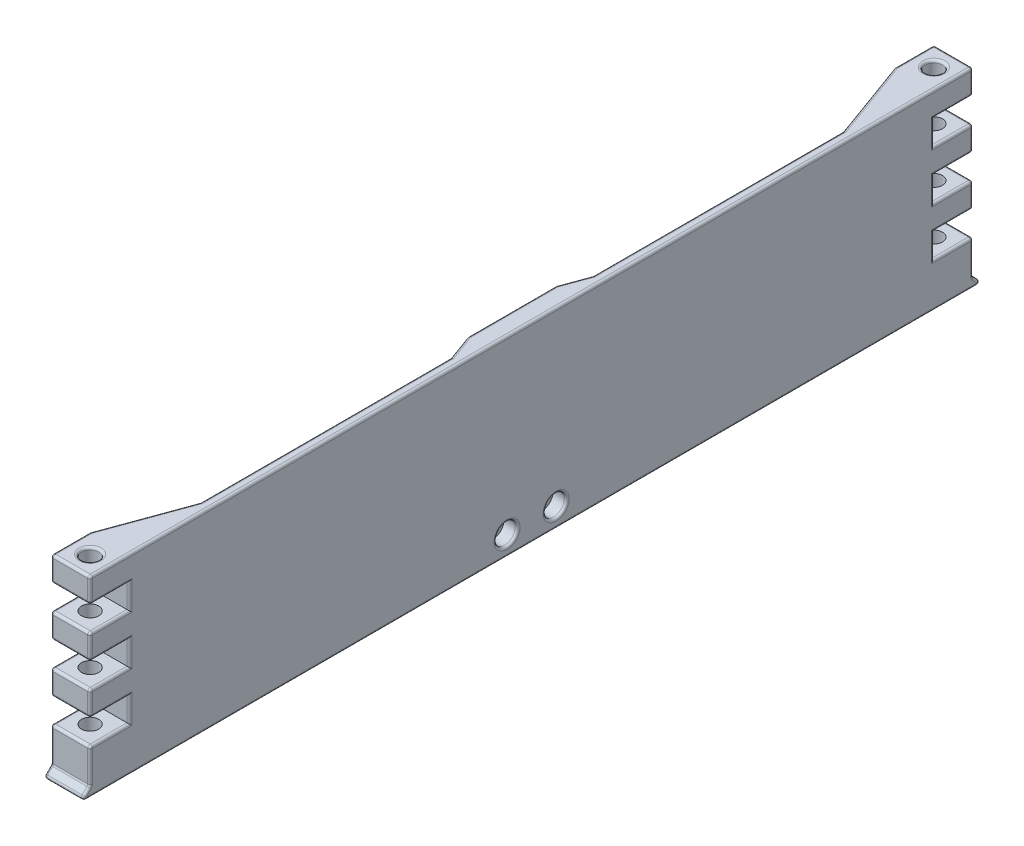
from build123d import *

# Parameters (mm, degrees)
SKETCH1_R               = 2.15
BOSS_EXTRUDE1_DEPTH     = 8
SKETCH1_3_R             = 2.15
BOSS_EXTRUDE2_DEPTH     = 5.2
CUT_EXTRUDE3_DEPTH      = 62.595454378
CUT_EXTRUDE3_DEPTH_BACK = 62.595454378
SKETCH7_R               = 1.75
CUT_EXTRUDE4_DEPTH      = 62.595454378
CUT_EXTRUDE4_DEPTH_BACK = 6
SKETCH7_3_R             = 1.75
CUT_EXTRUDE5_DEPTH      = 62.595454378
FILLET1_R               = 0.5


with BuildPart() as part:
    # Sketch1 → Boss-Extrude1 (new body)
    with BuildSketch(Plane(origin=(0, 0, 0), x_dir=(0, 0, -1), z_dir=(1, 0, 0))):
        Polygon((-47, -19.5), (-45, -19.5), (45, -19.5), (45, 19.5), (-37, 19.5), (-45, 19.5), (-45, 14.5), (-37, 14.5), (-37, 9.5), (-45, 9.5), (-45, 4.5), (-37, 4.5), (-37, -0.5), (-45, -0.5), (-45, -5.5), (-37, -5.5), (-37, -10.5), (-45, -10.5), (-45, -17.5), align=None)
        with Locations((40, -15.5)):
            Circle(SKETCH1_R, mode=Mode.SUBTRACT)
    extrude(amount=BOSS_EXTRUDE1_DEPTH)

    # Sketch1<3> → Boss-Extrude2 (add)
    with BuildSketch(Plane(origin=(0, 0, 0), x_dir=(0, 0, -1), z_dir=(1, 0, 0))):
        with Locations((40, -15.5)):
            Circle(SKETCH1_3_R)
    extrude(amount=BOSS_EXTRUDE2_DEPTH)

    # Sketch7 → Cut-Extrude3 (cut, two sides: drawn at the far end of the back side and taken through both)
    with BuildSketch(Plane.XZ.offset(19.5).offset(-CUT_EXTRUDE3_DEPTH_BACK)):
        with Locations((4, 41)):
            Circle(SKETCH7_R)
    extrude(amount=CUT_EXTRUDE3_DEPTH + CUT_EXTRUDE3_DEPTH_BACK, mode=Mode.SUBTRACT)

    # Sketch7<3> → Cut-Extrude4 (cut, two sides: drawn at the far end of the back side and taken through both)
    with BuildSketch(Plane.XZ.offset(19.5).offset(-CUT_EXTRUDE4_DEPTH_BACK)):
        Polygon((1.175, 42.63101451), (1.175, 39.36898549), (4, 37.737970979), (6.825, 39.36898549), (6.825, 42.63101451), (4, 44.262029021), align=None)
        with Locations((4, 41)):
            Circle(SKETCH7_3_R, mode=Mode.SUBTRACT)
    extrude(amount=CUT_EXTRUDE4_DEPTH + CUT_EXTRUDE4_DEPTH_BACK, mode=Mode.SUBTRACT)

    # Sketch8 → Cut-Extrude5 (cut, through all)
    with BuildSketch(Plane(origin=(0, 19.5, 0), x_dir=(1, 0, 0), z_dir=(0, 1, 0))):
        Polygon((0, 45), (0, -37), (6, -20.515135483), (6, 30.505045161), (4, 36), (4, 45), align=None)
    extrude(amount=-CUT_EXTRUDE5_DEPTH, mode=Mode.SUBTRACT)

    # Mirror2: part across plane


with BuildPart() as part_1:
    add(part.part)
    add(part.part.mirror(Plane(origin=(8, 0, -45), x_dir=(1, 0, 0), z_dir=(0, 0, 1))))

    # Fillet1
    fillet1_edges = [part_1.edges().sort_by_distance(p)[0] for p in [
        (3, -19.5, 28.757567742),
        (3, -19.5, -118.757567742),
        (0, -18.5, -136),
        (0, -18.5, 46),
        (4, -17.5, -135),
        (4, -10.5, -135),
        (0, -14, -135),
        (4, -5.5, -135),
        (4, -0.5, -135),
        (0, -3, -135),
        (4, 4.5, -135),
        (4, 9.5, -135),
        (0, 7, -135),
        (4, 14.5, -135),
        (0, 17, -135),
        (8, -10.5, 41),
        (8, -8, 37),
        (8, -5.5, 41),
        (8, -0.5, 41),
        (8, 2, 37),
        (8, 4.5, 41),
        (8, 9.5, 41),
        (8, 12, 37),
        (8, 14.5, 41),
        (8, 17, -135),
        (8, 14.5, -131),
        (8, 12, -127),
        (8, 9.5, -131),
        (8, 7, -135),
        (8, 4.5, -131),
        (8, 2, -127),
        (8, -0.5, -131),
        (8, -3, -135),
        (8, -5.5, -131),
        (8, -8, -127),
        (8, -10.5, -131),
        (8, -14, -135),
        (8, -18.5, -136),
        (8, -19.5, -45),
        (8, -18.5, 46),
        (4, -10.5, 45),
        (8, -14, 45),
        (4, -17.5, 45),
        (0, -14, 45),
        (4, -0.5, 45),
        (8, -3, 45),
        (4, -5.5, 45),
        (0, -3, 45),
        (4, 9.5, 45),
        (8, 7, 45),
        (4, 4.5, 45),
        (0, 7, 45),
        (8, 17, 45),
        (4, 14.5, 45),
        (0, 17, 45),
        (2.25, 19.5, -131),
        (2.25, 19.5, 41),
        (3, 19.5, -118.757567742),
        (0, 19.5, -131),
        (4, 19.5, -135),
        (8, 19.5, -45),
        (4, 19.5, 45),
        (0, 19.5, 41),
        (3, 19.5, 28.757567742),
        (0, -19.5, 42),
        (0, -19.5, -132),
        (0, 14.5, 41),
        (0, 9.5, 41),
        (0, 4.5, 41),
        (0, -0.5, 41),
        (0, -5.5, 41),
        (0, -10.5, 41),
        (0, -10.5, -131),
        (0, -5.5, -131),
        (0, -0.5, -131),
        (0, 4.5, -131),
        (0, 9.5, -131),
        (0, 14.5, -131),
        (4, -19.5, 47),
        (4, -19.5, -137),
        (8, -15.5, -52.15),
        (8, -15.5, -37.85),
        (6, 19.5, -4.994954839),
        (5, 19.5, -33.252522581),
        (4, 19.5, -45),
        (5, 19.5, -56.747477419),
        (6, 19.5, -85.005045161),
        (6, -19.5, -85.005045161),
        (5, -19.5, -56.747477419),
        (4, -19.5, -45),
        (5, -19.5, -33.252522581),
        (6, -19.5, -4.994954839),
    ]]
    fillet(fillet1_edges, radius=FILLET1_R)


solid = part_1.part
